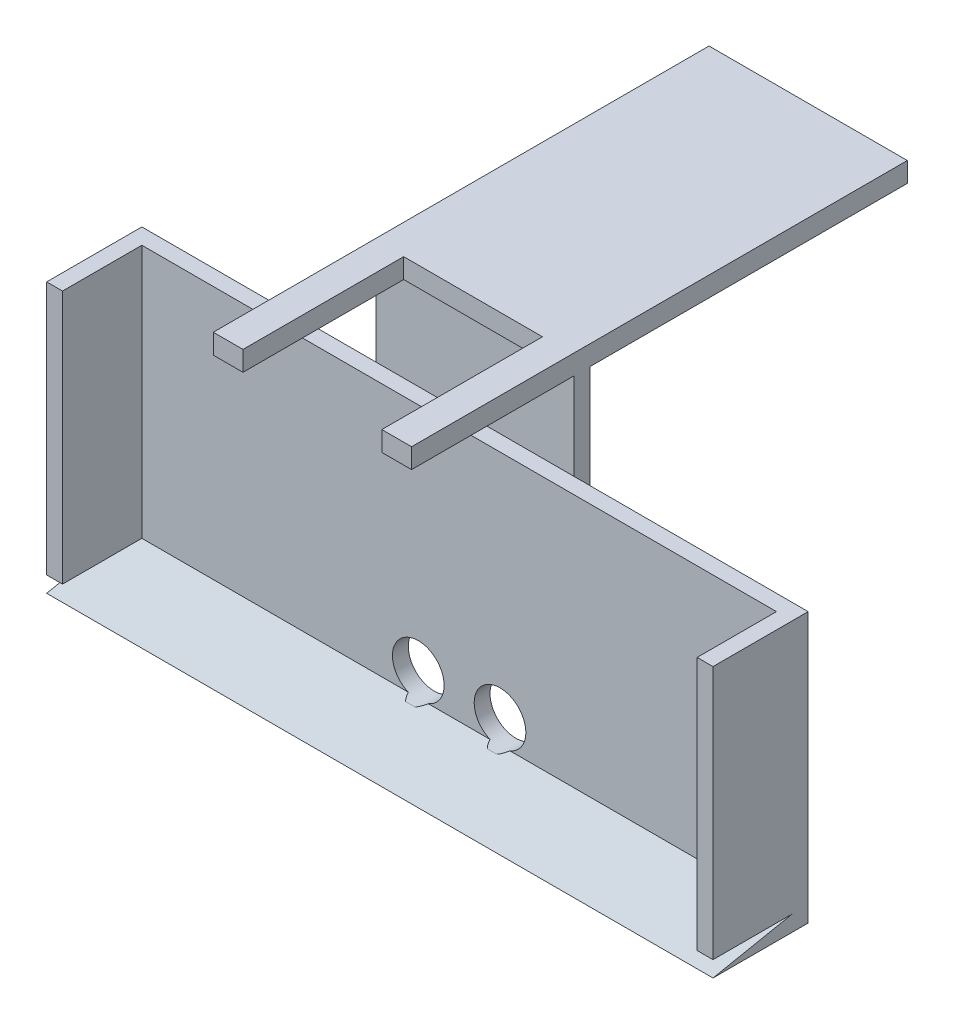
from build123d import *

# Parameters (mm, degrees)
SKETCH1_W               = 203.2
SKETCH1_H               = 25.4
BOSS_EXTRUDE1_DEPTH     = 5.08
BOSS_EXTRUDE2_DEPTH     = 5.08
SKETCH5_W               = 213.36
SKETCH5_H               = 86.36
BOSS_EXTRUDE3_DEPTH     = 5.08
CUT_EXTRUDE2_DEPTH      = 231.860710386
SKETCH7_W               = 63.5
SKETCH7_H               = 63.5
BOSS_EXTRUDE4_DEPTH     = 5.08
BOSS_EXTRUDE5_DEPTH     = 6.35
CUT_EXTRUDE3_REACH      = 205.537
SKETCH9_W               = 44.45
SKETCH9_H               = 58.324999377
CUT_EXTRUDE4_DEPTH      = 2.54
CUT_EXTRUDE4_DEPTH_BACK = 197.028932814
SKETCH10_R              = 8.2696685


with BuildPart() as part:
    # Sketch1 → Boss-Extrude1 (new body)
    with BuildSketch(Plane(origin=(0, 0, 0), x_dir=(1, 0, 0), z_dir=(0, 1, 0))):
        Rectangle(SKETCH1_W, SKETCH1_H)
    extrude(amount=BOSS_EXTRUDE1_DEPTH)

    # Sketch4 → Boss-Extrude2 (add)
    with BuildSketch(Plane(origin=(101.6, 0, 0), x_dir=(0, 0, -1), z_dir=(1, 0, 0))):
        Polygon((-12.7, 0), (-12.7, 5.08), (-12.7, 86.36), (12.7, 86.36), (12.7, 5.08), (12.7, 0), align=None)
    boss_extrude2 = extrude(amount=BOSS_EXTRUDE2_DEPTH)

    # Mirror1: Boss-Extrude2 across plane
    add(boss_extrude2.mirror(Plane(origin=(0, 0, 0), x_dir=(0, 0, 1), z_dir=(1, 0, 0))))

    # Sketch5 → Boss-Extrude3 (add)
    with BuildSketch(Plane(origin=(0, 0, -12.7), x_dir=(-1, 0, 0), z_dir=(0, 0, -1))):
        with Locations((0, 43.18)):
            Rectangle(SKETCH5_W, SKETCH5_H)
    extrude(amount=BOSS_EXTRUDE3_DEPTH)

    # Sketch6 → Cut-Extrude2 (cut, through all)
    with BuildSketch(Plane(origin=(106.68, 0, 0), x_dir=(0, 0, -1), z_dir=(1, 0, 0))):
        Polygon((-12.7, 0), (12.7, 5.08), (-12.7, 5.08), align=None)
    extrude(amount=-CUT_EXTRUDE2_DEPTH, mode=Mode.SUBTRACT)

    # Sketch7 → Boss-Extrude4 (add)
    with BuildSketch(Plane(origin=(0, 0, -17.78), x_dir=(-1, 0, 0), z_dir=(0, 0, -1))):
        with Locations((0, 82.55)):
            Rectangle(SKETCH7_W, SKETCH7_H)
    extrude(amount=BOSS_EXTRUDE4_DEPTH)

    # Sketch8 → Boss-Extrude5 (add)
    with BuildSketch(Plane(origin=(0, 114.3, 0), x_dir=(1, 0, 0), z_dir=(0, 1, 0))):
        Polygon((-31.75, 22.86), (-31.75, 124.46), (31.75, 124.46), (31.75, 22.86), (31.75, 17.78), (31.75, -34.281462789), (-31.75, -34.281462789), (-31.75, 17.78), align=None)
    extrude(amount=BOSS_EXTRUDE5_DEPTH)

    # Sketch9 → Cut-Extrude3 (cut, up to next)
    with BuildSketch(Plane(origin=(0, 120.65, 0), x_dir=(1, 0, 0), z_dir=(0, 1, 0)), mode=Mode.PRIVATE) as cut_extrude3_sk1:
        with Locations((0, -12.001142466)):
            Rectangle(SKETCH9_W, SKETCH9_H)
    cut_extrude3_tool1 = extrude(cut_extrude3_sk1.sketch, amount=-CUT_EXTRUDE3_REACH, mode=Mode.PRIVATE) & part.part
    add(cut_extrude3_tool1.solids().sort_by_distance((0, 120.65, 12.001142))[0], mode=Mode.SUBTRACT)

    # Sketch10 → Cut-Extrude4 (cut, two sides: drawn at the far end of the back side and taken through both)
    with BuildSketch(Plane.XY.offset(-12.7).offset(-CUT_EXTRUDE4_DEPTH_BACK)):
        with Locations((-13.081, 12.7)):
            Circle(SKETCH10_R)
        with Locations((13.081, 12.7)):
            Circle(SKETCH10_R)
    extrude(amount=CUT_EXTRUDE4_DEPTH + CUT_EXTRUDE4_DEPTH_BACK, mode=Mode.SUBTRACT)


solid = part.part
